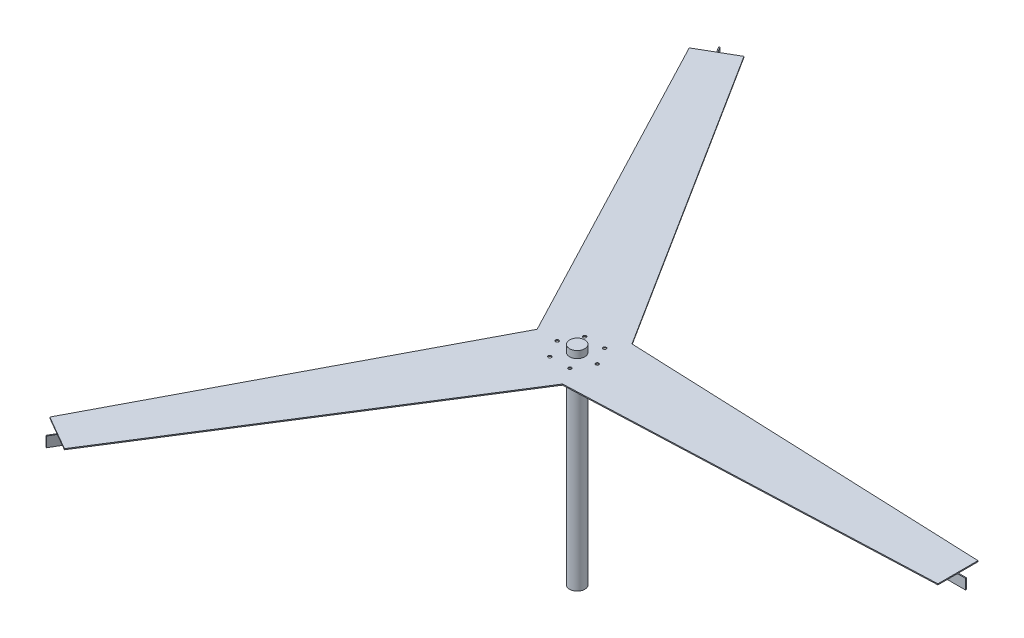
from build123d import *

# Parameters (mm, degrees)
CROQUIS1_R                   = 19.05
SALIENTE_EXTRUIR3_DEPTH      = 2.5
CROQUIS2_W                   = 885
CROQUIS2_H                   = 2.5
SALIENTE_EXTRUIR4_DEPTH      = 25.4
CROQUIS4_R                   = 4
CORTAR_EXTRUIR1_DEPTH        = 2.54
SALIENTE_EXTRUIR5_DEPTH      = 500
SALIENTE_EXTRUIR5_DEPTH_BACK = 20
CROQUIS5_R                   = 19.05
CROQUIS6_W                   = 2.5
CROQUIS6_H                   = 25.4
SALIENTE_EXTRUIR6_DEPTH      = 20
MATRIZC1_COUNT               = 3


with BuildPart() as part:
    # Croquis1 → Saliente-Extruir3 (new body)
    with BuildSketch(Plane(origin=(0, 0, 0), x_dir=(1, 0, 0), z_dir=(0, 1, 0))):
        Polygon((-518.301270189, -797.724133595), (-431.698729811, -847.724133595), (50, -86.602540378), (950, -50), (950, 50), (50, 86.602540378), (-431.698729811, 847.724133595), (-518.301270189, 797.724133595), (-100, 0), align=None)
        Circle(CROQUIS1_R, mode=Mode.SUBTRACT)
    extrude(amount=SALIENTE_EXTRUIR3_DEPTH)

    # Croquis2 → Saliente-Extruir4 (add)
    with BuildSketch(Plane.XZ):
        with Locations((507.5, 0)):
            Rectangle(CROQUIS2_W, CROQUIS2_H)
        Polygon((-473.917468245, -823.349133595), (-31.417468245, -56.916651246), (-33.582531755, -55.666651246), (-476.082531755, -822.099133595), align=None)
        Polygon((-476.082531755, 822.099133595), (-33.582531755, 55.666651246), (-31.417468245, 56.916651246), (-473.917468245, 823.349133595), align=None)
    extrude(amount=SALIENTE_EXTRUIR4_DEPTH)

    # Croquis4 → Cortar-Extruir1 (cut)
    with BuildSketch(Plane(origin=(0, 2.5, 0), x_dir=(1, 0, 0), z_dir=(0, 1, 0))):
        with Locations((25, -43.301270189)):
            Circle(CROQUIS4_R)
        with Locations((-25, -43.301270189)):
            Circle(CROQUIS4_R)
        with Locations((-50, 0)):
            Circle(CROQUIS4_R)
        with Locations((-25, 43.301270189)):
            Circle(CROQUIS4_R)
        with Locations((25, 43.301270189)):
            Circle(CROQUIS4_R)
        with Locations((50, 0)):
            Circle(CROQUIS4_R)
    extrude(amount=-CORTAR_EXTRUIR1_DEPTH, mode=Mode.SUBTRACT)

    # Croquis6 → Saliente-Extruir6 (add)
    with BuildSketch(Plane(origin=(950, 0, 0), x_dir=(0, 0, -1), z_dir=(1, 0, 0))):
        with Locations((0, -12.7)):
            Rectangle(CROQUIS6_W, CROQUIS6_H)
    saliente_extruir6 = extrude(amount=SALIENTE_EXTRUIR6_DEPTH)

    # MatrizC1: Saliente-Extruir6 ×3 about axis
    matrizc1_axis = Axis((0, 20, 0), (0, -1, 0))
    for i in range(1, MATRIZC1_COUNT):
        add(saliente_extruir6.rotate(matrizc1_axis, i * 360 / MATRIZC1_COUNT))


with BuildPart() as body_2:
    # Croquis5 → Saliente-Extruir5 (new, two sides: drawn at the far end of the back side and taken through both)
    with BuildSketch(Plane.XZ.offset(-SALIENTE_EXTRUIR5_DEPTH_BACK)):
        Circle(CROQUIS5_R)
    extrude(amount=SALIENTE_EXTRUIR5_DEPTH + SALIENTE_EXTRUIR5_DEPTH_BACK)


solid = Compound([part.part, body_2.part])
